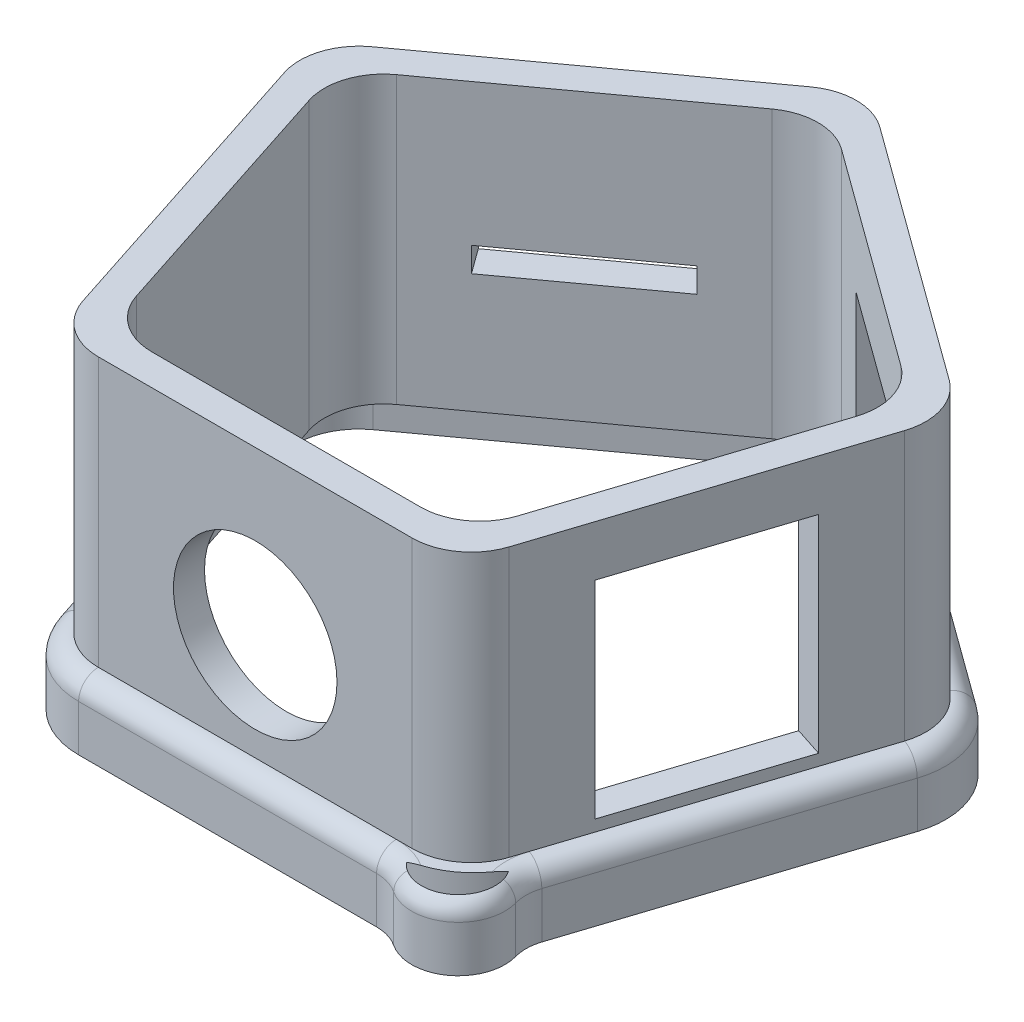
from build123d import *

# Parameters (mm, degrees)
SKETCH1_W                = 45.72
SKETCH1_H                = 31.75
SKETCH1_R                = 10.16
BOSS_EXTRUDE1_DEPTH      = 4
BOSS_EXTRUDE2_DEPTH      = 31.75
FILLET1_R                = 7.62
BOSS_EXTRUDE3_DEPTH      = 5.08
BOSS_EXTRUDE4_DEPTH      = 6.35
BOSS_EXTRUDE4_DEPTH_BACK = 2.159
BOSS_EXTRUDE5_START      = -8.509
BOSS_EXTRUDE5_DEPTH      = 8.509
CUT_EXTRUDE4_DEPTH       = 12.192
FILLET5_R                = 5.715
FILLET6_R                = 2.54
CUT_EXTRUDE5_DEPTH       = 6.35
SKETCH14_W               = 22.86
SKETCH14_H               = 26.67
CUT_EXTRUDE6_DEPTH       = 10.16
SKETCH15_W               = 17.78
SKETCH15_H               = 19.685
CUT_EXTRUDE7_DEPTH       = 10.16
SKETCH16_W               = 20.828
SKETCH16_H               = 3.175
CUT_EXTRUDE8_DEPTH       = 10.16
CUT_EXTRUDE9_START       = -9.398
SKETCH17_R               = 10.541
SKETCH17_R_2             = 10.16
CUT_EXTRUDE9_DEPTH       = 9.398


with BuildPart() as part:
    # Sketch1 → Boss-Extrude1 (new body)
    with BuildSketch(Plane.XY):
        Rectangle(SKETCH1_W, SKETCH1_H)
        Circle(SKETCH1_R, mode=Mode.SUBTRACT)
    extrude(amount=BOSS_EXTRUDE1_DEPTH)

    # Sketch2 → Boss-Extrude2 (add)
    with BuildSketch(Plane(origin=(0, 15.875, 0), x_dir=(1, 0, 0), z_dir=(0, 1, 0))):
        Polygon((36.988256983, 43.482303925), (22.86, 0), (22.86, -4), (25.766170112, -4), (41.690539001, 45.01016797), (0, 75.30011757), (-41.690539001, 45.01016797), (-25.766170112, -4), (-22.86, -4), (-22.86, 0), (-36.988256983, 43.482303925), (0, 70.35584566), align=None)
    extrude(amount=-BOSS_EXTRUDE2_DEPTH)

    # Fillet1
    fillet1_edges = [part.edges().sort_by_distance(p)[0] for p in [
        (0, 0, -75.30011757),
        (41.690539001, 0, -45.01016797),
        (25.766170112, 0, 4),
        (36.988256983, 0, -43.482303925),
        (0, 0, -70.35584566),
        (-36.988256983, 0, -43.482303925),
        (-25.766170112, 0, 4),
        (-41.690539001, 0, -45.01016797),
        (-22.86, 0, 0),
        (22.86, 0, 0),
    ]]
    fillet(fillet1_edges, radius=FILLET1_R)

    # Sketch6 → Boss-Extrude3 (add)
    with BuildSketch(Plane(origin=(0, 15.875, 0), x_dir=(1, 0, 0), z_dir=(0, 1, 0))):
        with BuildLine():
            Line((-20.229916049, -4), (20.229916049, -4))
            ThreePointArc((20.229916049, -4), (24.708839671, -2.544709497), (27.476966703, 1.265290503))
            Line((27.476966703, 1.265290503), (39.97974241, 39.744877467))
            ThreePointArc((39.97974241, 39.744877467), (39.97974241, 44.454296461), (37.211615379, 48.264296461))
            Line((37.211615379, 48.264296461), (4.478923622, 72.045989078))
            ThreePointArc((4.478923622, 72.045989078), (0, 73.501279581), (-4.478923622, 72.045989078))
            Line((-4.478923622, 72.045989078), (-37.211615379, 48.264296461))
            ThreePointArc((-37.211615379, 48.264296461), (-39.97974241, 44.454296461), (-39.97974241, 39.744877467))
            Line((-39.97974241, 39.744877467), (-27.476966703, 1.265290503))
            ThreePointArc((-27.476966703, 1.265290503), (-24.708839671, -2.544709497), (-20.229916049, -4))
        make_face()
        with BuildLine():
            Line((24.570796591, 5.265290503), (35.277460392, 38.217013422))
            ThreePointArc((35.277460392, 38.217013422), (35.277460392, 42.926432416), (32.50933336, 46.736432416))
            Line((32.50933336, 46.736432416), (4.478923622, 67.101717168))
            ThreePointArc((4.478923622, 67.101717168), (0, 68.557007671), (-4.478923622, 67.101717168))
            Line((-4.478923622, 67.101717168), (-32.50933336, 46.736432416))
            ThreePointArc((-32.50933336, 46.736432416), (-35.277460392, 42.926432416), (-35.277460392, 38.217013422))
            Line((-35.277460392, 38.217013422), (-24.570796591, 5.265290503))
            ThreePointArc((-24.570796591, 5.265290503), (-21.802669559, 1.455290503), (-17.323745937, 0))
            Line((-17.323745937, 0), (17.323745937, 0))
            ThreePointArc((17.323745937, 0), (21.802669559, 1.455290503), (24.570796591, 5.265290503))
        make_face(mode=Mode.SUBTRACT)
    extrude(amount=BOSS_EXTRUDE3_DEPTH)

    # Sketch8 → Boss-Extrude4 (add, two sides: drawn at the far end of the back side and taken through both)
    with BuildSketch(Plane.XZ.offset(15.875).offset(-BOSS_EXTRUDE4_DEPTH_BACK)):
        with BuildLine():
            Line((5.971898163, -74.100892244), (38.70458992, -50.319199627))
            ThreePointArc((38.70458992, -50.319199627), (42.395425962, -45.239199627), (42.395425962, -38.959974301))
            Line((42.395425962, -38.959974301), (29.892650254, -0.480387337))
            ThreePointArc((29.892650254, -0.480387337), (26.201814212, 4.599612663), (20.229916049, 6.54))
            Line((20.229916049, 6.54), (-20.229916049, 6.54))
            ThreePointArc((-20.229916049, 6.54), (-26.201814212, 4.599612663), (-29.892650254, -0.480387337))
            Line((-29.892650254, -0.480387337), (-42.395425962, -38.959974301))
            ThreePointArc((-42.395425962, -38.959974301), (-42.395425962, -45.239199627), (-38.70458992, -50.319199627))
            Line((-38.70458992, -50.319199627), (-5.971898163, -74.100892244))
            ThreePointArc((-5.971898163, -74.100892244), (0, -76.041279581), (5.971898163, -74.100892244))
        make_face()
        with BuildLine():
            Line((39.97974241, -39.744877467), (27.476966703, -1.265290503))
            ThreePointArc((27.476966703, -1.265290503), (24.708839671, 2.544709497), (20.229916049, 4))
            Line((20.229916049, 4), (-20.229916049, 4))
            ThreePointArc((-20.229916049, 4), (-24.708839671, 2.544709497), (-27.476966703, -1.265290503))
            Line((-27.476966703, -1.265290503), (-39.97974241, -39.744877467))
            ThreePointArc((-39.97974241, -39.744877467), (-39.97974241, -44.454296461), (-37.211615379, -48.264296461))
            Line((-37.211615379, -48.264296461), (-4.478923622, -72.045989078))
            ThreePointArc((-4.478923622, -72.045989078), (0, -73.501279581), (4.478923622, -72.045989078))
            Line((4.478923622, -72.045989078), (37.211615379, -48.264296461))
            ThreePointArc((37.211615379, -48.264296461), (39.97974241, -44.454296461), (39.97974241, -39.744877467))
        make_face(mode=Mode.SUBTRACT)
    extrude(amount=BOSS_EXTRUDE4_DEPTH + BOSS_EXTRUDE4_DEPTH_BACK)

    # Sketch11 → Boss-Extrude5 (add)
    with BuildSketch(Plane.XZ.offset(22.225).offset(BOSS_EXTRUDE5_START)):
        with BuildLine():
            Line((19.948787859, 5.414930333), (27.190045273, 1.56775587))
            Line((27.190045273, 1.56775587), (29.892650254, -0.480387337))
            ThreePointArc((29.892650254, -0.480387337), (26.201814212, 4.599612663), (20.229916049, 6.54))
            Line((20.229916049, 6.54), (19.948787859, 5.414930333))
        make_face()
        with BuildLine():
            ThreePointArc((20.229916049, 6.54), (28.196740294, 7.345392854), (29.892650254, -0.480387337))
            ThreePointArc((29.892650254, -0.480387337), (26.201814212, 4.599612663), (20.229916049, 6.54))
        make_face()
    extrude(amount=BOSS_EXTRUDE5_DEPTH)

    # Sketch12 → Cut-Extrude4 (cut)
    with BuildSketch(Plane.XZ.offset(22.225)):
        with BuildLine():
            ThreePointArc((28.787792432, 0.145862767), (27.450253023, 6.317941272), (21.166935135, 5.682739694))
            ThreePointArc((21.166935135, 5.682739694), (25.637505825, 3.822908801), (28.787792432, 0.145862767))
        make_face()
    extrude(amount=-CUT_EXTRUDE4_DEPTH, mode=Mode.SUBTRACT)

    # Fillet5
    fillet5_edges = [part.edges().sort_by_distance(p)[0] for p in [
        (20.229916049, -17.9705, 6.54),
        (29.892650254, -17.9705, -0.480387337),
    ]]
    fillet(fillet5_edges, radius=FILLET5_R)

    # Fillet6
    # the kernel refuses this fillet: 2.54 mm, written as the material it takes off along each edge
    with BuildSketch(Plane(origin=(32.732691756, -13.716, -42.099586964), x_dir=(0.5877852522924708, 0, -0.809016994374949), z_dir=(-0.809016994374949, 0, -0.5877852522924708))) as fillet6_piece_1:
        with BuildLine():
            CenterArc((10.16 - FILLET6_R, FILLET6_R), FILLET6_R, 270, 90)
            Line((10.16 - FILLET6_R, 0), (10.16, 0))
            Line((10.16, 0), (10.16, FILLET6_R))
        make_face()
    revolve(axis=Axis((32.732691756, -13.716, -42.099586964), (0, -1, 0)), revolution_arc=72, mode=Mode.SUBTRACT)
    with BuildSketch(Plane(origin=(5.971898163, -13.716, -74.100892244), x_dir=(0, -1, 0), z_dir=(0.8090169943749487, 0, 0.5877852522924716)), Plane(origin=(-38.70458992, -13.716, -50.319199627), x_dir=(0, -1, 0), z_dir=(0.8090169943749469, 0, -0.5877852522924739)), Plane(origin=(-29.892650254, -13.716, -0.480387337), x_dir=(0, -1, 0), z_dir=(-0.3090169943749508, 0, -0.9510565162951525))) as fillet6_piece_2:
        with BuildLine():
            CenterArc((FILLET6_R, -FILLET6_R), FILLET6_R, 90, 90)
            Line((0, -FILLET6_R), (0, 0))
            Line((0, 0), (FILLET6_R, 0))
        make_face()
    extrude(amount=40.459832097, mode=Mode.SUBTRACT)
    with BuildSketch(Plane(origin=(0, -13.716, -65.881279581), x_dir=(-0.5877852522924719, 0, -0.8090169943749482), z_dir=(-0.8090169943749482, 0, 0.5877852522924719))) as fillet6_piece_3:
        with BuildLine():
            CenterArc((10.16 - FILLET6_R, FILLET6_R), FILLET6_R, 270, 90)
            Line((10.16 - FILLET6_R, 0), (10.16, 0))
            Line((10.16, 0), (10.16, FILLET6_R))
        make_face()
    revolve(axis=Axis((0, -13.716, -65.881279581), (0, -1, 0)), revolution_arc=72, mode=Mode.SUBTRACT)
    with BuildSketch(Plane(origin=(-32.732691756, -13.716, -42.099586964), x_dir=(-0.9510565162951536, 0, 0.30901699437494734), z_dir=(0.30901699437494734, 0, 0.9510565162951536))) as fillet6_piece_4:
        with BuildLine():
            CenterArc((10.16 - FILLET6_R, FILLET6_R), FILLET6_R, 270, 90)
            Line((10.16 - FILLET6_R, 0), (10.16, 0))
            Line((10.16, 0), (10.16, FILLET6_R))
        make_face()
    revolve(axis=Axis((-32.732691756, -13.716, -42.099586964), (0, -1, 0)), revolution_arc=72, mode=Mode.SUBTRACT)
    with BuildSketch(Plane(origin=(-20.229916049, -13.716, -3.62), x_dir=(0, 0, 1), z_dir=(1, 0, 0))) as fillet6_piece_5:
        with BuildLine():
            CenterArc((10.16 - FILLET6_R, FILLET6_R), FILLET6_R, 270, 90)
            Line((10.16 - FILLET6_R, 0), (10.16, 0))
            Line((10.16, 0), (10.16, FILLET6_R))
        make_face()
    revolve(axis=Axis((-20.229916049, -13.716, -3.62), (0, -1, 0)), revolution_arc=72, mode=Mode.SUBTRACT)
    with BuildSketch(Plane(origin=(18.184374257, -13.716, 6.54), x_dir=(0, -1, 0), z_dir=(-1, 0, 0)), Plane(origin=(42.395425962, -13.716, -38.959974301), x_dir=(0, -1, 0), z_dir=(-0.30901699437494484, 0, 0.9510565162951544))) as fillet6_piece_6:
        with BuildLine():
            CenterArc((FILLET6_R, -FILLET6_R), FILLET6_R, 90, 90)
            Line((0, -FILLET6_R), (0, 0))
            Line((0, 0), (FILLET6_R, 0))
        make_face()
    extrude(amount=38.414290306, mode=Mode.SUBTRACT)
    with BuildSketch(Plane(origin=(18.184374257, -13.716, 12.255), x_dir=(0, 0, -1), z_dir=(-1, 0, 0))) as fillet6_piece_7:
        with BuildLine():
            CenterArc((5.715 + FILLET6_R, FILLET6_R), FILLET6_R, 180, 90)
            Line((5.715 + FILLET6_R, 0), (5.715, 0))
            Line((5.715, 0), (5.715, FILLET6_R))
        make_face()
    revolve(axis=Axis((18.184374257, -13.716, 12.255), (0, -1, 0)), revolution_arc=33.548768752, mode=Mode.SUBTRACT)
    with BuildSketch(Plane(origin=(35.960045421, -13.716, -0.659781065), x_dir=(-0.9510565162951543, 0, -0.30901699437494495), z_dir=(0.30901699437494495, 0, -0.9510565162951543))) as fillet6_piece_8:
        with BuildLine():
            CenterArc((5.715 + FILLET6_R, -FILLET6_R), FILLET6_R, 90, 90)
            Line((5.715 + FILLET6_R, 0), (5.715, 0))
            Line((5.715, 0), (5.715, -FILLET6_R))
        make_face()
    revolve(axis=Axis((35.960045421, -13.716, -0.659781065), (0, 1, 0)), revolution_arc=33.548768752, mode=Mode.SUBTRACT)
    with BuildSketch(Plane(origin=(24.664153166, -13.716, 2.483203799), x_dir=(-0.5526465683039513, 0, 0.8334157249187624), z_dir=(-0.8334157249187624, 0, -0.5526465683039513))) as fillet6_piece_9:
        with BuildLine():
            CenterArc((6.009996192 - FILLET6_R, -FILLET6_R), FILLET6_R, 0, 90)
            Line((6.009996192 - FILLET6_R, 0), (6.009996192, 0))
            Line((6.009996192, 0), (6.009996192, -FILLET6_R))
        make_face()
    revolve(axis=Axis((24.664153166, -13.716, 2.483203799), (0, 1, 0)), revolution_arc=139.097537505, mode=Mode.SUBTRACT)

    # Sketch13 → Cut-Extrude5 (cut)
    # profile 1 of 2: a face of its own
    with BuildSketch(Plane.XZ.offset(22.225)):
        with BuildLine():
            Line((20.229916049, 4.6), (-20.229916049, 4.6))
            ThreePointArc((-20.229916049, 4.6), (-25.061510822, 3.030119694), (-28.047600613, -1.079880306))
            Line((-28.047600613, -1.079880306), (-40.55037632, -39.559467271))
            ThreePointArc((-40.55037632, -39.559467271), (-40.55037632, -44.639706658), (-37.56428653, -48.749706658))
            Line((-37.56428653, -48.749706658), (-4.831594774, -72.531399275))
            ThreePointArc((-4.831594774, -72.531399275), (0, -74.101279581), (4.831594774, -72.531399275))
            Line((4.831594774, -72.531399275), (37.56428653, -48.749706658))
            ThreePointArc((37.56428653, -48.749706658), (40.55037632, -44.639706658), (40.55037632, -39.559467271))
            Line((40.55037632, -39.559467271), (28.047600613, -1.079880306))
            ThreePointArc((28.047600613, -1.079880306), (25.061510822, 3.030119694), (20.229916049, 4.6))
        make_face()
        with BuildLine():
            Line((39.97974241, -39.744877467), (27.476966703, -1.265290503))
            ThreePointArc((27.476966703, -1.265290503), (24.708839671, 2.544709497), (20.229916049, 4))
            Line((20.229916049, 4), (-20.229916049, 4))
            ThreePointArc((-20.229916049, 4), (-24.708839671, 2.544709497), (-27.476966703, -1.265290503))
            Line((-27.476966703, -1.265290503), (-39.97974241, -39.744877467))
            ThreePointArc((-39.97974241, -39.744877467), (-39.97974241, -44.454296461), (-37.211615379, -48.264296461))
            Line((-37.211615379, -48.264296461), (-4.478923622, -72.045989078))
            ThreePointArc((-4.478923622, -72.045989078), (0, -73.501279581), (4.478923622, -72.045989078))
            Line((4.478923622, -72.045989078), (37.211615379, -48.264296461))
            ThreePointArc((37.211615379, -48.264296461), (39.97974241, -44.454296461), (39.97974241, -39.744877467))
        make_face(mode=Mode.SUBTRACT)
    # profile 2 of 2: a face of its own
    with BuildSketch(Plane.XZ.offset(22.225)):
        with BuildLine():
            ThreePointArc((28.787792432, 0.145862767), (27.450253023, 6.317941272), (21.166935135, 5.682739694))
            ThreePointArc((21.166935135, 5.682739694), (25.637505825, 3.822908801), (28.787792432, 0.145862767))
        make_face()
    extrude(amount=-CUT_EXTRUDE5_DEPTH, mode=Mode.SUBTRACT)

    # Sketch14 → Cut-Extrude6 (cut)
    with BuildSketch(Plane(origin=(24.481290311, 0, 7.954453411), x_dir=(0.30901699437494484, 0, -0.9510565162951544), z_dir=(0.9510565162951544, 0, 0.30901699437494484))):
        with Locations((29.924128491, 1.0795)):
            Rectangle(SKETCH14_W, SKETCH14_H)
    extrude(amount=-CUT_EXTRUDE6_DEPTH, mode=Mode.SUBTRACT)

    # Sketch15 → Cut-Extrude7 (cut)
    with BuildSketch(Plane(origin=(35.807333746, 0, -49.284566789), x_dir=(-0.8090169943749486, 0, -0.5877852522924718), z_dir=(0.5877852522924718, 0, -0.8090169943749486))):
        with Locations((18.494128491, 1.0795)):
            Rectangle(SKETCH15_W, SKETCH15_H)
    extrude(amount=-CUT_EXTRUDE7_DEPTH, mode=Mode.SUBTRACT)

    # Sketch16 → Cut-Extrude8 (cut)
    with BuildSketch(Plane(origin=(-35.807333746, 0, -49.284566789), x_dir=(-0.8090169943749469, 0, 0.5877852522924738), z_dir=(-0.5877852522924738, 0, -0.8090169943749469))):
        with Locations((-18.494128491, 1.0795)):
            Rectangle(SKETCH16_W, SKETCH16_H)
    extrude(amount=-CUT_EXTRUDE8_DEPTH, mode=Mode.SUBTRACT)

    # Sketch17 → Cut-Extrude9 (cut)
    with BuildSketch(Plane.XY.offset(4).offset(CUT_EXTRUDE9_START)):
        Circle(SKETCH17_R)
        Circle(SKETCH17_R_2, mode=Mode.SUBTRACT)
    extrude(amount=CUT_EXTRUDE9_DEPTH, mode=Mode.SUBTRACT)


solid = part.part
